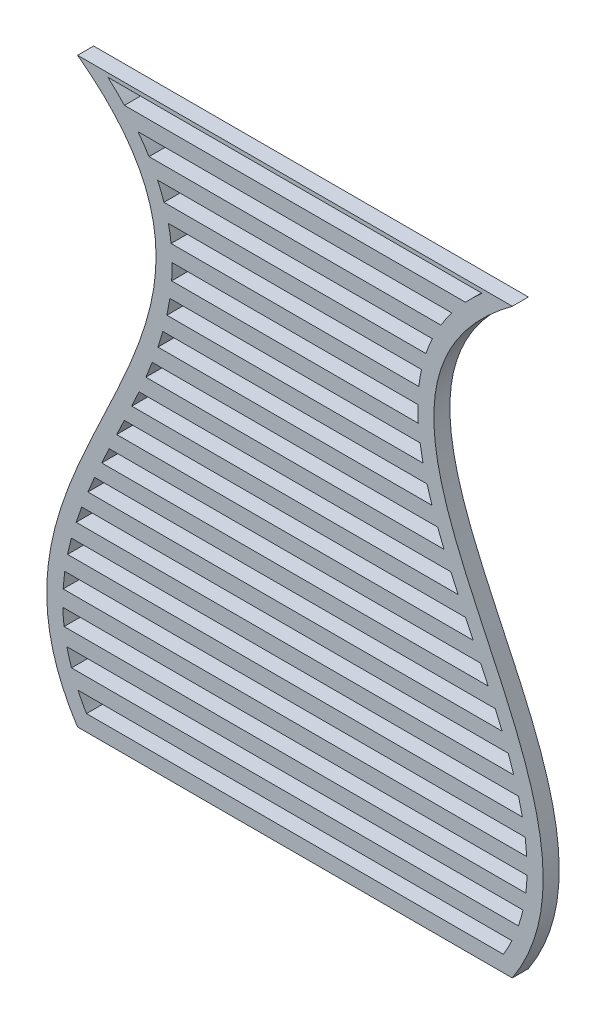
from build123d import *

# Parameters (mm, degrees)
BOSS_EXTRUDE1_DEPTH = 10
CUT_EXTRUDE1_DEPTH  = 239.430800717
LPATTERN1_DEPTH     = 10


# Read off the part's stored shape, not the designer's step: LPattern1
with BuildPart() as part:
    # Sketch1 → Boss-Extrude1 (new body)
    with BuildSketch(Plane.XY):
        with BuildLine():
            Line((-135.418143451, 181.213075779), (135.418143451, 181.213075779))
            add(Edge.make_bspline(
                [(135.418143451, 181.213075779), (-8.503748537, 74.516188349), (219.52905409, -52.879053946), (135.418143451, -181.213075779)],
                knots=[0, 0, 0, 0, 1, 1, 1, 1], degree=3))
            Line((135.418143451, -181.213075779), (-135.418143451, -181.213075779))
            add(Edge.make_bspline(
                [(-135.418143451, 181.213075779), (8.503748537, 74.516188349), (-219.52905409, -52.879053946), (-135.418143451, -181.213075779)],
                knots=[0, 0, 0, 0, 1, 1, 1, 1], degree=3))
        make_face()
    extrude(amount=BOSS_EXTRUDE1_DEPTH)

    # Sketch2 → Cut-Extrude1 (cut, through all)
    with BuildSketch(Plane.XY.offset(10)):
        with BuildLine():
            add(Edge.make_bspline(
                [(-135.171896743, -161.213075779), (-133.627785756, -164.532208828), (-131.869822051, -167.864239382), (-129.878221961, -171.213075779)],
                knots=[0.958992061, 0.958992061, 0.958992061, 0.958992061, 0.987298782, 0.987298782, 0.987298782, 0.987298782], degree=3))
            Line((-129.878221961, -171.213075779), (129.878221961, -171.213075779))
            add(Edge.make_bspline(
                [(129.878221961, -171.213075779), (131.869822051, -167.864239382), (133.627785756, -164.532208827), (135.171896743, -161.213075779)],
                knots=[0.012701218, 0.012701218, 0.012701218, 0.012701218, 0.041007939, 0.041007939, 0.041007939, 0.041007939], degree=3))
            Line((135.171896743, -161.213075779), (-135.171896743, -161.213075779))
        make_face()
    extrude(amount=-CUT_EXTRUDE1_DEPTH, mode=Mode.SUBTRACT)

    # LPattern1 outline → LPattern1 (cut)
    with BuildSketch(Plane.XY):
        with BuildLine():
            Line((116.533440817, 178.786924222), (-116.533440816, 178.786924221))
            add(Edge.make_bspline(
                [(-116.533440816, 178.786924221), (-112.819547365, 175.492075094), (-109.390809964, 172.159504509), (-106.234825345, 168.786924221)],
                knots=[0.03076654, 0.03076654, 0.03076654, 0.03076654, 0.059493429, 0.059493429, 0.059493429, 0.059493429], degree=3))
            Line((-106.234825345, 168.786924221), (106.234825345, 168.786924221))
            add(Edge.make_bspline(
                [(106.234825345, 168.786924221), (109.390809964, 172.159504509), (112.819547366, 175.492075095), (116.533440817, 178.786924222)],
                knots=[0.940506571, 0.940506571, 0.940506571, 0.940506571, 0.96923346, 0.96923346, 0.96923346, 0.96923346], degree=3))
        make_face()
        with BuildLine():
            Line((97.756811939, 158.786924221), (-97.756811939, 158.786924221))
            add(Edge.make_bspline(
                [(-97.756811939, 158.786924221), (-97.189981404, 158.043757745), (-96.635392803, 157.29877209), (-94.227971029, 153.98439953), (-92.506659859, 151.39539562), (-90.925433538, 148.786924221)],
                knots=[0.087562119, 0.087562119, 0.087562119, 0.087562119, 0.09375, 0.09375, 0.115024716, 0.115024716, 0.115024716, 0.115024716], degree=3))
            Line((-90.925433538, 148.786924221), (90.925433538, 148.786924221))
            add(Edge.make_bspline(
                [(90.925433538, 148.786924221), (92.506659859, 151.39539562), (94.227971029, 153.98439953), (96.635392803, 157.29877209), (97.189981404, 158.043757745), (97.756811939, 158.786924221)],
                knots=[0.884975284, 0.884975284, 0.884975284, 0.884975284, 0.90625, 0.90625, 0.912437881, 0.912437881, 0.912437881, 0.912437881], degree=3))
        make_face()
        with BuildLine():
            Line((85.584089894, 138.786924221), (-85.584089894, 138.786924221))
            add(Edge.make_bspline(
                [(-85.584089894, 138.786924221), (-84.756870332, 137.005781714), (-83.990519964, 135.217570703), (-82.676579104, 131.881995413), (-82.11339829, 130.336238496), (-81.59310002, 128.786924221)],
                knots=[0.141969913, 0.141969913, 0.141969913, 0.141969913, 0.15625, 0.15625, 0.168517707, 0.168517707, 0.168517707, 0.168517707], degree=3))
            Line((-81.59310002, 128.786924221), (81.59310002, 128.786924221))
            add(Edge.make_bspline(
                [(81.59310002, 128.786924221), (82.11339829, 130.336238496), (82.676579104, 131.881995413), (83.990519964, 135.217570703), (84.756870332, 137.005781714), (85.584089894, 138.786924221)],
                knots=[0.831482293, 0.831482293, 0.831482293, 0.831482293, 0.84375, 0.84375, 0.858030087, 0.858030087, 0.858030087, 0.858030087], degree=3))
        make_face()
        with BuildLine():
            Line((78.828225059, 118.786924221), (-78.828225059, 118.786924221))
            add(Edge.make_bspline(
                [(-78.828225059, 118.786924221), (-78.161171157, 115.740480089), (-77.647704456, 112.687271672), (-77.242986815, 109.350965329), (-77.20999503, 109.068947594), (-77.178211533, 108.786924221)],
                knots=[0.194803941, 0.194803941, 0.194803941, 0.194803941, 0.21875, 0.21875, 0.220960985, 0.220960985, 0.220960985, 0.220960985], degree=3))
            Line((-77.178211533, 108.786924221), (77.178211533, 108.786924221))
            add(Edge.make_bspline(
                [(77.178211533, 108.786924221), (77.20999503, 109.068947594), (77.242986815, 109.350965329), (77.647704456, 112.687271672), (78.161171157, 115.740480089), (78.828225059, 118.786924221)],
                knots=[0.779039015, 0.779039015, 0.779039015, 0.779039015, 0.78125, 0.78125, 0.805196059, 0.805196059, 0.805196059, 0.805196059], degree=3))
        make_face()
        with BuildLine():
            Line((76.541682798, 98.786924222), (-76.541682798, 98.786924221))
            add(Edge.make_bspline(
                [(-76.541682798, 98.786924221), (-76.535705099, 98.41746571), (-76.531609768, 98.048060061), (-76.511414096, 94.710113769), (-76.6134597, 91.745854292), (-76.823978811, 88.786924221)],
                knots=[0.247100497, 0.247100497, 0.247100497, 0.247100497, 0.25, 0.25, 0.27330462, 0.27330462, 0.27330462, 0.27330462], degree=3))
            Line((-76.823978811, 88.786924221), (76.823978811, 88.786924221))
            add(Edge.make_bspline(
                [(76.823978811, 88.786924221), (76.6134597, 91.745854292), (76.511414096, 94.710113769), (76.531609768, 98.048060061), (76.535705099, 98.41746571), (76.541682798, 98.786924222)],
                knots=[0.72669538, 0.72669538, 0.72669538, 0.72669538, 0.75, 0.75, 0.752899503, 0.752899503, 0.752899503, 0.752899503], degree=3))
        make_face()
        with BuildLine():
            Line((77.935190302, 78.786924221), (-77.935190302, 78.786924221))
            add(Edge.make_bspline(
                [(-77.935190302, 78.786924221), (-78.178873031, 77.158333725), (-78.451733654, 75.531713435), (-79.067516103, 72.198279349), (-79.413308698, 70.491555656), (-79.78716613, 68.786924221)],
                knots=[0.299615287, 0.299615287, 0.299615287, 0.299615287, 0.3125, 0.3125, 0.326054678, 0.326054678, 0.326054678, 0.326054678], degree=3))
            Line((-79.78716613, 68.786924221), (79.78716613, 68.786924221))
            add(Edge.make_bspline(
                [(79.78716613, 68.786924221), (79.413308698, 70.491555656), (79.067516103, 72.198279349), (78.451733654, 75.531713435), (78.178873031, 77.158333725), (77.935190302, 78.786924221)],
                knots=[0.673945322, 0.673945322, 0.673945322, 0.673945322, 0.6875, 0.6875, 0.700384713, 0.700384713, 0.700384713, 0.700384713], degree=3))
        make_face()
        with BuildLine():
            Line((82.293530773, 58.786924221), (-82.293530773, 58.786924221))
            add(Edge.make_bspline(
                [(-82.293530773, 58.786924221), (-83.079486743, 55.985293579), (-83.931070105, 53.188644126), (-85.01363958, 49.85973232), (-85.190244093, 49.323252659), (-85.36887947, 48.786924221)],
                knots=[0.352621482, 0.352621482, 0.352621482, 0.352621482, 0.375, 0.375, 0.379300831, 0.379300831, 0.379300831, 0.379300831], degree=3))
            Line((-85.36887947, 48.786924221), (85.36887947, 48.786924221))
            add(Edge.make_bspline(
                [(85.36887947, 48.786924221), (85.190244093, 49.323252659), (85.01363958, 49.85973232), (83.931070105, 53.188644126), (83.079486743, 55.985293579), (82.293530773, 58.786924221)],
                knots=[0.620699169, 0.620699169, 0.620699169, 0.620699169, 0.625, 0.625, 0.647378518, 0.647378518, 0.647378518, 0.647378518], degree=3))
        make_face()
        with BuildLine():
            Line((88.927051505, 38.786924221), (-88.927051505, 38.786924221))
            add(Edge.make_bspline(
                [(-88.927051505, 38.786924221), (-90.185970249, 35.44921304), (-91.509830543, 32.116259569), (-92.884378807, 28.786924221)],
                knots=[0.406074891, 0.406074891, 0.406074891, 0.406074891, 0.432925255, 0.432925255, 0.432925255, 0.432925255], degree=3))
            Line((-92.884378807, 28.786924221), (92.884378807, 28.786924221))
            add(Edge.make_bspline(
                [(92.884378807, 28.786924221), (91.509830543, 32.116259569), (90.185970249, 35.44921304), (88.927051505, 38.786924221)],
                knots=[0.567074745, 0.567074745, 0.567074745, 0.567074745, 0.593925109, 0.593925109, 0.593925109, 0.593925109], degree=3))
        make_face()
        with BuildLine():
            Line((97.156145322, 18.786924221), (-97.156145322, 18.786924221))
            add(Edge.make_bspline(
                [(-97.156145322, 18.786924221), (-98.624516539, 15.450760304), (-100.13030141, 12.1175952), (-101.65981924, 8.786924221)],
                knots=[0.459834887, 0.459834887, 0.459834887, 0.459834887, 0.486792905, 0.486792905, 0.486792905, 0.486792905], degree=3))
            Line((-101.65981924, 8.786924221), (101.65981924, 8.786924221))
            add(Edge.make_bspline(
                [(101.65981924, 8.786924221), (100.13030141, 12.1175952), (98.624516539, 15.450760304), (97.156145322, 18.786924221)],
                knots=[0.513207095, 0.513207095, 0.513207095, 0.513207095, 0.540165113, 0.540165113, 0.540165113, 0.540165113], degree=3))
        make_face()
        with BuildLine():
            Line((106.313040562, -1.21307578), (-106.313040562, -1.213075779))
            add(Edge.make_bspline(
                [(-106.313040562, -1.213075779), (-107.881088662, -4.548844676), (-109.459425181, -7.882244207), (-111.034569574, -11.213075779)],
                knots=[0.513791622, 0.513791622, 0.513791622, 0.513791622, 0.540828904, 0.540828904, 0.540828904, 0.540828904], degree=3))
            Line((-111.034569574, -11.213075779), (111.034569574, -11.213075779))
            add(Edge.make_bspline(
                [(111.034569574, -11.213075779), (109.459425181, -7.882244207), (107.881088662, -4.548844677), (106.313040562, -1.21307578)],
                knots=[0.459171096, 0.459171096, 0.459171096, 0.459171096, 0.486208378, 0.486208378, 0.486208378, 0.486208378], degree=3))
        make_face()
        with BuildLine():
            Line((115.744155093, -21.213075779), (-115.744155093, -21.213075779))
            add(Edge.make_bspline(
                [(-115.744155093, -21.213075779), (-117.304571813, -24.549618446), (-118.848222007, -27.883234857), (-120.36175554, -31.213075779)],
                knots=[0.567907959, 0.567907959, 0.567907959, 0.567907959, 0.595035361, 0.595035361, 0.595035361, 0.595035361], degree=3))
            Line((-120.36175554, -31.213075779), (120.36175554, -31.213075779))
            add(Edge.make_bspline(
                [(120.36175554, -31.213075779), (118.848222007, -27.883234857), (117.304571813, -24.549618446), (115.744155093, -21.213075779)],
                knots=[0.404964639, 0.404964639, 0.404964639, 0.404964639, 0.432092041, 0.432092041, 0.432092041, 0.432092041], degree=3))
        make_face()
        with BuildLine():
            Line((124.80847614, -41.21307578), (-124.80847614, -41.213075779))
            add(Edge.make_bspline(
                [(-124.80847614, -41.213075779), (-124.955785708, -41.552909844), (-125.102639925, -41.892695474), (-126.540687418, -45.230184732), (-127.79573602, -48.224068389), (-129.004717462, -51.213075779)],
                knots=[0.622224435, 0.622224435, 0.622224435, 0.622224435, 0.625, 0.625, 0.64949093, 0.64949093, 0.64949093, 0.64949093], degree=3))
            Line((-129.004717462, -51.213075779), (129.004717462, -51.213075779))
            add(Edge.make_bspline(
                [(129.004717462, -51.213075779), (127.79573602, -48.224068389), (126.540687418, -45.230184732), (125.102639925, -41.892695474), (124.955785709, -41.552909844), (124.80847614, -41.21307578)],
                knots=[0.35050907, 0.35050907, 0.35050907, 0.35050907, 0.375, 0.375, 0.377775565, 0.377775565, 0.377775565, 0.377775565], degree=3))
        make_face()
        with BuildLine():
            Line((132.871691223, -61.213075778), (-132.871691223, -61.213075779))
            add(Edge.make_bspline(
                [(-132.871691223, -61.213075779), (-133.347214893, -62.506739211), (-133.812043782, -63.799269245), (-134.983029242, -67.134622135), (-135.671883303, -69.175565299), (-136.329124153, -71.213075779)],
                knots=[0.676856874, 0.676856874, 0.676856874, 0.676856874, 0.6875, 0.6875, 0.704347153, 0.704347153, 0.704347153, 0.704347153], degree=3))
            Line((-136.329124153, -71.213075779), (136.329124153, -71.213075779))
            add(Edge.make_bspline(
                [(136.329124153, -71.213075779), (135.671883303, -69.175565299), (134.983029242, -67.134622135), (133.812043782, -63.799269244), (133.347214893, -62.50673921), (132.871691223, -61.213075778)],
                knots=[0.295652847, 0.295652847, 0.295652847, 0.295652847, 0.3125, 0.3125, 0.323143126, 0.323143126, 0.323143126, 0.323143126], degree=3))
        make_face()
        with BuildLine():
            Line((139.296389446, -81.213075779), (-139.296389446, -81.213075779))
            add(Edge.make_bspline(
                [(-139.296389446, -81.213075779), (-139.879943466, -83.37829125), (-140.422041032, -85.538951657), (-141.190048133, -88.868969052), (-141.44755613, -90.041780499), (-141.691234576, -91.213075779)],
                knots=[0.731989328, 0.731989328, 0.731989328, 0.731989328, 0.75, 0.75, 0.759811394, 0.759811394, 0.759811394, 0.759811394], degree=3))
            Line((-141.691234576, -91.213075779), (141.691234576, -91.213075779))
            add(Edge.make_bspline(
                [(141.691234576, -91.213075779), (141.44755613, -90.041780499), (141.190048133, -88.868969052), (140.422041032, -85.538951657), (139.879943466, -83.37829125), (139.296389446, -81.213075779)],
                knots=[0.240188606, 0.240188606, 0.240188606, 0.240188606, 0.25, 0.25, 0.268010672, 0.268010672, 0.268010672, 0.268010672], degree=3))
        make_face()
        with BuildLine():
            Line((143.429190048, -101.213075779), (-143.429190048, -101.213075779))
            add(Edge.make_bspline(
                [(-143.429190048, -101.213075779), (-143.832842262, -104.1355145), (-144.140059144, -107.048303276), (-144.372272442, -110.372151028), (-144.399482536, -110.792713658), (-144.424482057, -111.213075779)],
                knots=[0.787837049, 0.787837049, 0.787837049, 0.787837049, 0.8125, 0.8125, 0.816074633, 0.816074633, 0.816074633, 0.816074633], degree=3))
            Line((-144.424482057, -111.213075779), (144.424482057, -111.213075779))
            add(Edge.make_bspline(
                [(144.424482057, -111.213075779), (144.399482536, -110.792713658), (144.372272442, -110.372151028), (144.140059144, -107.048303276), (143.832842262, -104.1355145), (143.429190048, -101.213075779)],
                knots=[0.183925367, 0.183925367, 0.183925367, 0.183925367, 0.1875, 0.1875, 0.212162951, 0.212162951, 0.212162951, 0.212162951], degree=3))
        make_face()
        with BuildLine():
            Line((144.589033051, -121.213075778), (-144.589033051, -121.213075779))
            add(Edge.make_bspline(
                [(-144.589033051, -121.213075779), (-144.495187784, -124.554391556), (-144.247369369, -127.886506711), (-143.833040833, -131.213075779)],
                knots=[0.844518063, 0.844518063, 0.844518063, 0.844518063, 0.873117968, 0.873117968, 0.873117968, 0.873117968], degree=3))
            Line((-143.833040833, -131.213075779), (143.833040833, -131.213075779))
            add(Edge.make_bspline(
                [(143.833040833, -131.213075779), (144.247369369, -127.886506711), (144.495187784, -124.554391555), (144.589033051, -121.213075778)],
                knots=[0.126882032, 0.126882032, 0.126882032, 0.126882032, 0.155481937, 0.155481937, 0.155481937, 0.155481937], degree=3))
        make_face()
        with BuildLine():
            Line((142.069385373, -141.213075779), (-142.069385373, -141.213075779))
            add(Edge.make_bspline(
                [(-142.069385373, -141.213075779), (-141.304360602, -144.542919335), (-140.356391725, -147.874084749), (-139.209045482, -151.213075779)],
                knots=[0.901802531, 0.901802531, 0.901802531, 0.901802531, 0.930464382, 0.930464382, 0.930464382, 0.930464382], degree=3))
            Line((-139.209045482, -151.213075779), (139.209045482, -151.213075779))
            add(Edge.make_bspline(
                [(139.209045482, -151.213075779), (140.356391725, -147.874084749), (141.304360602, -144.542919335), (142.069385373, -141.213075779)],
                knots=[0.069535618, 0.069535618, 0.069535618, 0.069535618, 0.098197469, 0.098197469, 0.098197469, 0.098197469], degree=3))
        make_face()
    extrude(amount=LPATTERN1_DEPTH, mode=Mode.SUBTRACT)


solid = part.part
